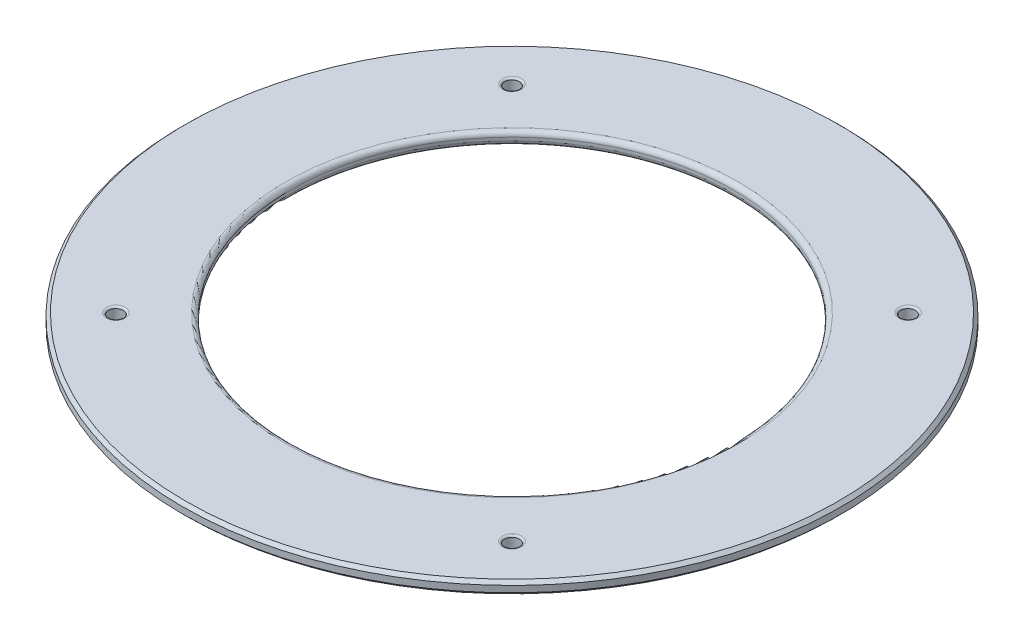
from build123d import *

# Parameters (mm, degrees)
SKETCH2_R             = 104
BOSS_EXTRUDE3_DEPTH   = 4
F_1_0MM_DOWEL_HOLE1_D = 4.6
SKETCH7_R             = 70
CUT_EXTRUDE1_DEPTH    = 4
FILLET1_R             = 1.5
SKETCH8_R             = 2.85
CUT_EXTRUDE2_DEPTH    = 3.5
SKETCH8_3_R           = 2.85
CUT_EXTRUDE3_DEPTH    = 3.5
CHAMFER1_SIZE         = 1
FILLET2_R             = 0.7
FILLET3_R             = 0.7
FILLET4_R             = 0.7
FILLET5_R             = 0.7


with BuildPart() as part:
    # Sketch2 → Boss-Extrude3 (new body)
    with BuildSketch(Plane(origin=(0, 0, 0), x_dir=(1, 0, 0), z_dir=(0, 1, 0))):
        with Locations(Location((0, 0, 0), (0, 0, 270))):
            Circle(SKETCH2_R)
    extrude(amount=BOSS_EXTRUDE3_DEPTH)

    # Ø1.0mm Dowel Hole1 (through all)
    with Locations(Plane(origin=(0, 4, 0), x_dir=(1, 0, 0), z_dir=(0, 1, 0))):
        with Locations((-62.5, 62.5), (62.5, 62.5), (62.5, -62.5), (-62.5, -62.5)):
            Hole(F_1_0MM_DOWEL_HOLE1_D / 2)

    # Sketch7 → Cut-Extrude1 (cut)
    with BuildSketch(Plane(origin=(0, 4, 0), x_dir=(1, 0, 0), z_dir=(0, 1, 0))):
        with Locations(Location((0, 0, 0), (0, 0, 270))):
            Circle(SKETCH7_R)
    extrude(amount=-CUT_EXTRUDE1_DEPTH, mode=Mode.SUBTRACT)

    # Fillet1
    fillet1_edges = [part.edges().sort_by_distance(p)[0] for p in [
        (0, 0, -70),
        (0, 4, -70),
    ]]
    fillet(fillet1_edges, radius=FILLET1_R)

    # Sketch8 → Cut-Extrude2 (cut)
    with BuildSketch(Plane.XZ):
        with Locations(Location((-62.5, 62.5, 0), (0, 0, 270))):
            Circle(SKETCH8_R)
    extrude(amount=-CUT_EXTRUDE2_DEPTH, mode=Mode.SUBTRACT)

    # Sketch8<3> → Cut-Extrude3 (cut)
    with BuildSketch(Plane.XZ):
        with Locations(Location((-62.5, -62.5, 0), (0, 0, 270))):
            Circle(SKETCH8_3_R)
        with Locations(Location((62.5, -62.5, 0), (0, 0, 270))):
            Circle(SKETCH8_3_R)
        with Locations(Location((62.5, 62.5, 0), (0, 0, 270))):
            Circle(SKETCH8_3_R)
        with Locations(Location((-62.5, 62.5, 0), (0, 0, 270))):
            Circle(SKETCH8_3_R)
    extrude(amount=-CUT_EXTRUDE3_DEPTH, mode=Mode.SUBTRACT)

    # Chamfer1
    chamfer1_edges = [part.edges().sort_by_distance(p)[0] for p in [
        (0, 0, -104),
        (0, 4, -104),
    ]]
    chamfer(chamfer1_edges, length=CHAMFER1_SIZE)

    # Fillet2
    # the kernel refuses this fillet: 0.7 mm, written as the material it takes off along each edge
    with BuildSketch(Plane(origin=(-62.5, 4, -62.5), x_dir=(-1, 0, 0), z_dir=(0, 0, 1))) as fillet2_piece_1:
        with BuildLine():
            CenterArc((2.970820393, 0.7), FILLET2_R, 196.601549599, 73.398450401)
            Line((2.970820393, 0), (2.970820393, -0.014))
            Line((2.970820393, -0.014), (2.3, -0.014))
            Line((2.3, -0.014), (2.286, 0))
            ThreePointArc((2.286, 0), (2.286, 0.25), (2.286583592, 0.496))
            Line((2.286583592, 0.496), (2.3, 0.5))
        make_face()
    revolve(axis=Axis((-62.5, 4, -62.5), (0, -1, 0)), mode=Mode.SUBTRACT)

    # Fillet3
    # the kernel refuses this fillet: 0.7 mm, written as the material it takes off along each edge
    with BuildSketch(Plane(origin=(62.5, 4, -62.5), x_dir=(-1, 0, 0), z_dir=(0, 0, 1))) as fillet3_piece_1:
        with BuildLine():
            CenterArc((2.970820393, 0.7), FILLET3_R, 196.601549599, 73.398450401)
            Line((2.970820393, 0), (2.970820393, -0.014))
            Line((2.970820393, -0.014), (2.3, -0.014))
            Line((2.3, -0.014), (2.286, 0))
            ThreePointArc((2.286, 0), (2.286, 0.25), (2.286583592, 0.496))
            Line((2.286583592, 0.496), (2.3, 0.5))
        make_face()
    revolve(axis=Axis((62.5, 4, -62.5), (0, -1, 0)), mode=Mode.SUBTRACT)

    # Fillet4
    # the kernel refuses this fillet: 0.7 mm, written as the material it takes off along each edge
    with BuildSketch(Plane(origin=(62.5, 4, 62.5), x_dir=(-1, 0, 0), z_dir=(0, 0, 1))) as fillet4_piece_1:
        with BuildLine():
            CenterArc((2.970820393, 0.7), FILLET4_R, 196.601549599, 73.398450401)
            Line((2.970820393, 0), (2.970820393, -0.014))
            Line((2.970820393, -0.014), (2.3, -0.014))
            Line((2.3, -0.014), (2.286, 0))
            ThreePointArc((2.286, 0), (2.286, 0.25), (2.286583592, 0.496))
            Line((2.286583592, 0.496), (2.3, 0.5))
        make_face()
    revolve(axis=Axis((62.5, 4, 62.5), (0, -1, 0)), mode=Mode.SUBTRACT)

    # Fillet5
    # the kernel refuses this fillet: 0.7 mm, written as the material it takes off along each edge
    with BuildSketch(Plane(origin=(-62.5, 4, 62.5), x_dir=(-1, 0, 0), z_dir=(0, 0, 1))) as fillet5_piece_1:
        with BuildLine():
            CenterArc((2.970820393, 0.7), FILLET5_R, 196.601549599, 73.398450401)
            Line((2.970820393, 0), (2.970820393, -0.014))
            Line((2.970820393, -0.014), (2.3, -0.014))
            Line((2.3, -0.014), (2.286, 0))
            ThreePointArc((2.286, 0), (2.286, 0.25), (2.286583592, 0.496))
            Line((2.286583592, 0.496), (2.3, 0.5))
        make_face()
    revolve(axis=Axis((-62.5, 4, 62.5), (0, -1, 0)), mode=Mode.SUBTRACT)


solid = part.part
